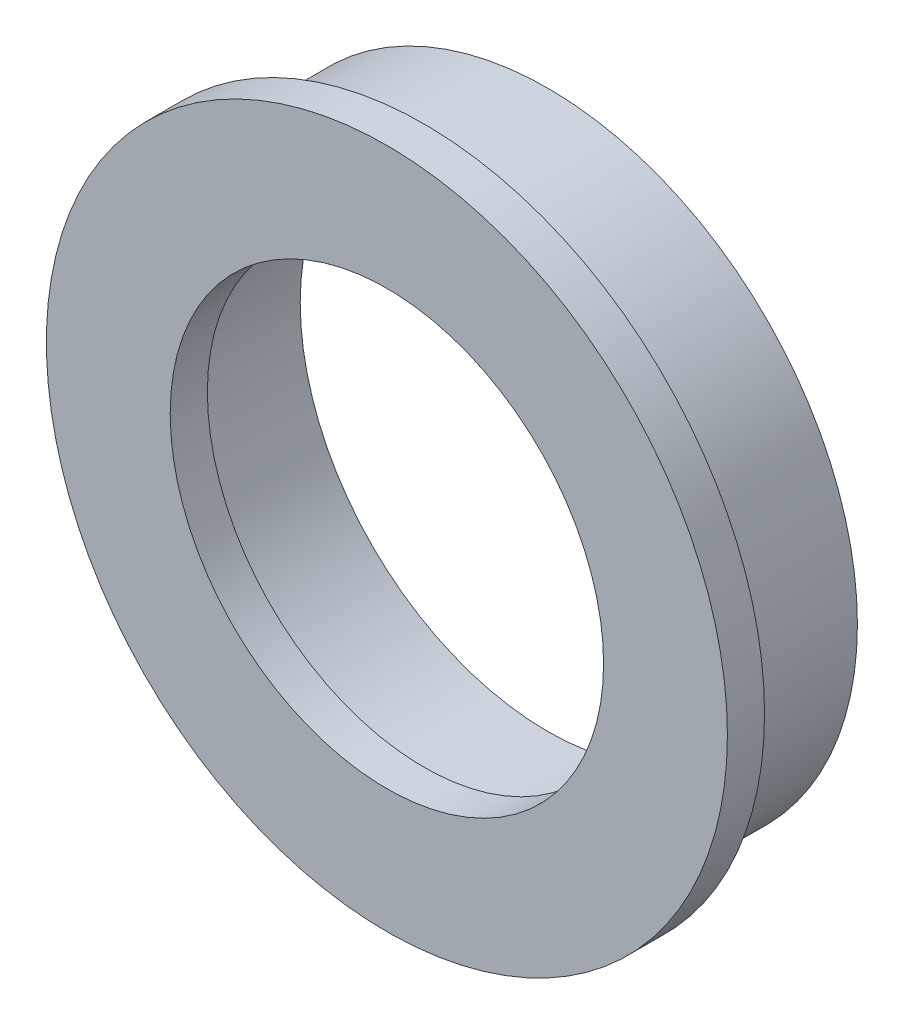
from build123d import *

# Parameters (mm, degrees)
SKETCH_1_R          = 25
EXTRUDE_2_DEPTH     = 10
EXTRUDE_START       = 10
SKETCH_2_R          = 27.5
EXTRUDE_3_DEPTH     = 3
SKETCH_3_R          = 20
CUT_EXTRUDE_1_DEPTH = 10
SKETCH_4_R          = 17.5
CUT_EXTRUDE_2_DEPTH = 13


with BuildPart() as part:
    # Эскиз1 → Бобышка-Вытянуть2 (new body)
    with BuildSketch(Plane.XY):
        Circle(SKETCH_1_R)
    extrude(amount=EXTRUDE_2_DEPTH)

    # Эскиз2 → Бобышка-Вытянуть3 (add)
    with BuildSketch(Plane.XY.offset(EXTRUDE_START)):
        Circle(SKETCH_2_R)
    extrude(amount=EXTRUDE_3_DEPTH)

    # Эскиз3 → Вырез-Вытянуть1 (cut)
    with BuildSketch(Plane.XY):
        Circle(SKETCH_3_R)
    extrude(amount=CUT_EXTRUDE_1_DEPTH, mode=Mode.SUBTRACT)

    # Эскиз4 → Вырез-Вытянуть2 (cut)
    with BuildSketch(Plane.XY):
        Circle(SKETCH_4_R)
    extrude(amount=CUT_EXTRUDE_2_DEPTH, mode=Mode.SUBTRACT)


solid = part.part
